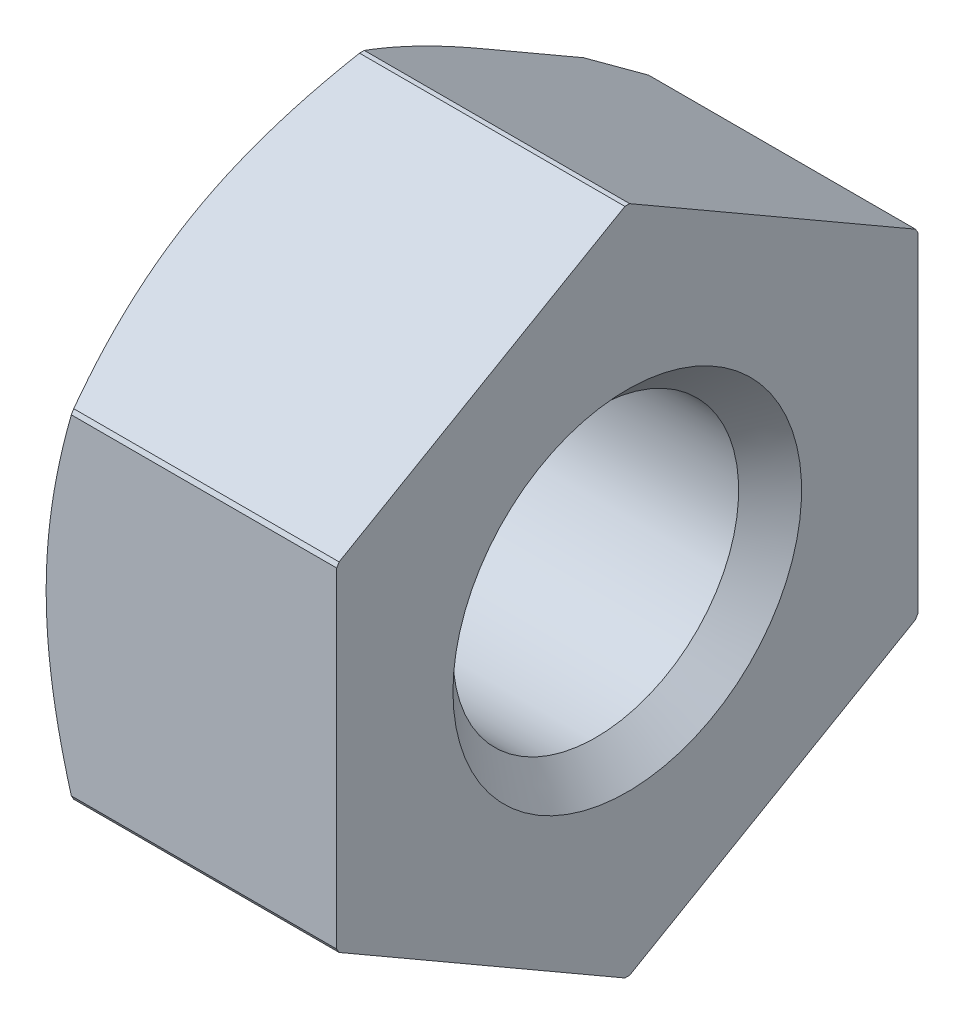
from build123d import *
from OCP.BRepFilletAPI import BRepFilletAPI_MakeChamfer

# Parameters (mm, degrees)
BOSS_EXTRUDE1_DEPTH = 5
HOLE1_D             = 4.917
CHAMFER1_SIZE       = 0.75
CHAMFER1_SIZE_2     = 0.433012702
CHAMFER2_SIZE       = 0.5415


with BuildPart() as part:
    # Sketch1 → Boss-Extrude1 (new body)
    with BuildSketch(Plane(origin=(-2.5, 0, 0), x_dir=(0, -1, 0), z_dir=(-1, 0, 0))):
        with BuildLine():
            Line((5.749854105, 0.040960553), (2.910399932, 4.959039447))
            ThreePointArc((2.910399932, 4.959039447), (2.875, 4.979646072), (2.839454173, 5))
            Line((2.839454173, 5), (-2.839454173, 5))
            ThreePointArc((-2.839454173, 5), (-2.875, 4.979646072), (-2.910399932, 4.959039447))
            Line((-2.910399932, 4.959039447), (-5.749854105, 0.040960553))
            ThreePointArc((-5.749854105, 0.040960553), (-5.75, 0), (-5.749854105, -0.040960553))
            Line((-5.749854105, -0.040960553), (-2.910399932, -4.959039447))
            ThreePointArc((-2.910399932, -4.959039447), (-2.875, -4.979646072), (-2.839454173, -5))
            Line((-2.839454173, -5), (2.839454173, -5))
            ThreePointArc((2.839454173, -5), (2.875, -4.979646072), (2.910399932, -4.959039447))
            Line((2.910399932, -4.959039447), (5.749854105, -0.040960553))
            ThreePointArc((5.749854105, -0.040960553), (5.75, 0), (5.749854105, 0.040960553))
        make_face()
    extrude(amount=-BOSS_EXTRUDE1_DEPTH)

    # Hole1 (through all)
    with Locations(Plane.ZY.offset(2.5)):
        with Locations((0, 0)):
            Hole(HOLE1_D / 2)

    # Chamfer1
    chamfer1_edges_1 = [part.edges().sort_by_distance(p)[0] for p in [
        (-2.5, -5.75, 0),
    ]]
    chamfer1_side_1 = [part.faces().sort_by_distance(p)[0] for p in [
        (-2.5, -5.741339746, 0),
    ]]
    chamfer1_edges_2 = [part.edges().sort_by_distance(p)[0] for p in [
        (-2.5, 5.75, 0),
    ]]
    chamfer1_side_2 = [part.faces().sort_by_distance(p)[0] for p in [
        (-2.491339746, 5.75, 0),
    ]]
    chamfer1_edges_3 = [part.edges().sort_by_distance(p)[0] for p in [
        (-2.5, 0, -5),
    ]]
    chamfer1_side_3 = [part.faces().sort_by_distance(p)[0] for p in [
        (-2.5, 0, -4.991339746),
    ]]
    chamfer1_edges_4 = [part.edges().sort_by_distance(p)[0] for p in [
        (-2.5, -2.875, -4.979646072),
    ]]
    chamfer1_side_4 = [part.faces().sort_by_distance(p)[0] for p in [
        (-2.5, -2.870669873, -4.972146072),
    ]]
    chamfer1_edges_5 = [part.edges().sort_by_distance(p)[0] for p in [
        (-2.5, 2.875, 4.979646072),
    ]]
    chamfer1_side_5 = [part.faces().sort_by_distance(p)[0] for p in [
        (-2.5, 2.870669873, 4.972146072),
    ]]
    chamfer1_edges_6 = [part.edges().sort_by_distance(p)[0] for p in [
        (-2.5, -2.875, 4.979646072),
    ]]
    chamfer1_side_6 = [part.faces().sort_by_distance(p)[0] for p in [
        (-2.5, -2.870669873, 4.972146072),
    ]]
    chamfer1 = BRepFilletAPI_MakeChamfer(part.part.solid().wrapped)
    for e in chamfer1_edges_1:
        chamfer1.Add(CHAMFER1_SIZE - 0.0001, CHAMFER1_SIZE_2 - 0.0001, e.wrapped, chamfer1_side_1[0].wrapped)
    for e in chamfer1_edges_2:
        chamfer1.Add(CHAMFER1_SIZE_2 - 0.0001, CHAMFER1_SIZE - 0.0001, e.wrapped, chamfer1_side_2[0].wrapped)
    for e in chamfer1_edges_3:
        chamfer1.Add(CHAMFER1_SIZE - 0.0001, CHAMFER1_SIZE_2 - 0.0001, e.wrapped, chamfer1_side_3[0].wrapped)
    for e in chamfer1_edges_4:
        chamfer1.Add(CHAMFER1_SIZE - 0.0001, CHAMFER1_SIZE_2 - 0.0001, e.wrapped, chamfer1_side_4[0].wrapped)
    for e in chamfer1_edges_5:
        chamfer1.Add(CHAMFER1_SIZE - 0.0001, CHAMFER1_SIZE_2 - 0.0001, e.wrapped, chamfer1_side_5[0].wrapped)
    for e in chamfer1_edges_6:
        chamfer1.Add(CHAMFER1_SIZE - 0.0001, CHAMFER1_SIZE_2 - 0.0001, e.wrapped, chamfer1_side_6[0].wrapped)
    add(Compound.cast(chamfer1.Shape()), mode=Mode.REPLACE)  # a hair under: the kernel refuses the full size

    # Chamfer2
    chamfer2_edges = [part.edges().sort_by_distance(p)[0] for p in [
        (-2.5, 0, 2.4585),
        (2.5, 0, 2.4585),
    ]]
    chamfer(chamfer2_edges, length=CHAMFER2_SIZE)


solid = part.part
